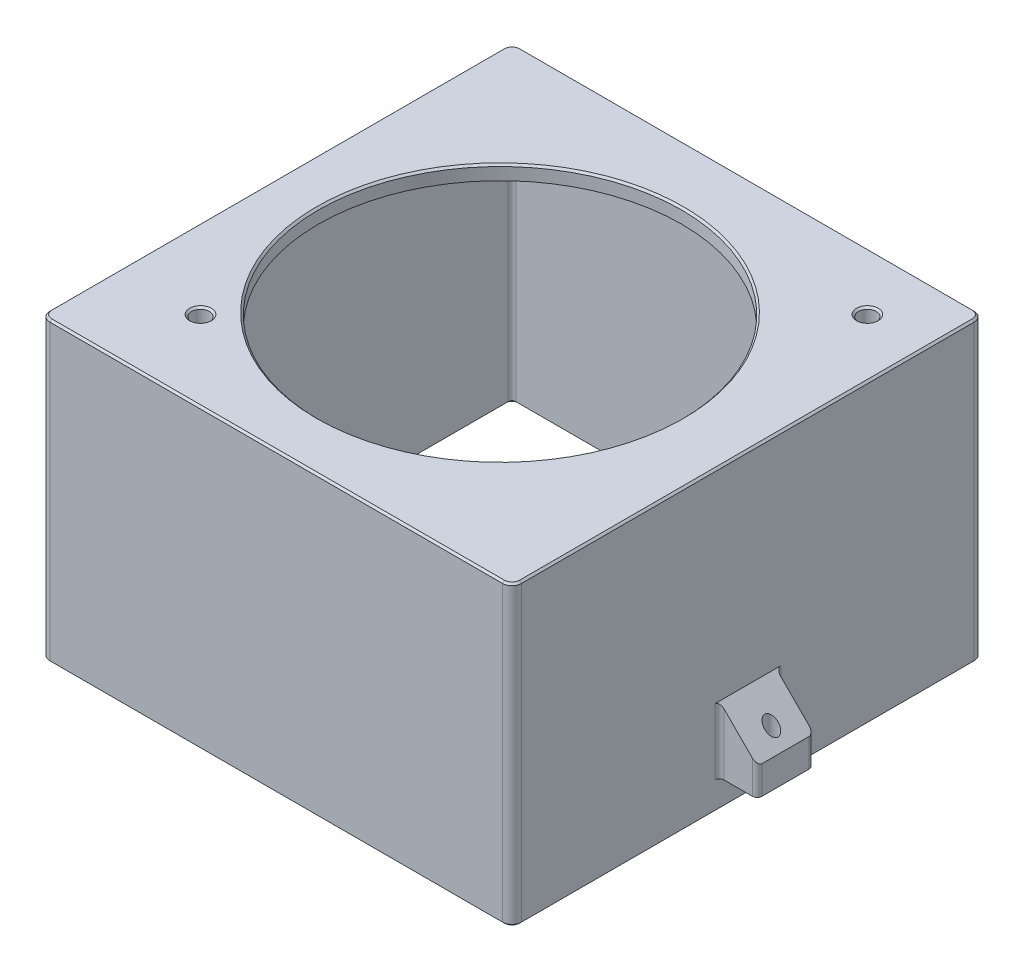
from build123d import *

# Parameters (mm, degrees)
SKETCH_1_W          = 100
SKETCH_1_H          = 100
SKETCH_1_R          = 1.9
EXTRUDE_1_DEPTH     = 3
SKETCH_2_R          = 38.5
CUT_EXTRUDE_1_DEPTH = 10
SKETCH_3_W          = 100
SKETCH_3_H          = 100
SKETCH_3_W_2        = 94
SKETCH_3_H_2        = 94
EXTRUDE_2_DEPTH     = 60
FILLET_1_R          = 2
CHAMFER_1_SIZE      = 0.4
FILLET_2_R          = 0.8
CHAMFER_2_SIZE      = 0.4
SKETCH_4_W          = 8
SKETCH_4_H          = 12
EXTRUDE_3_DEPTH     = 6
CHAMFER_3_SIZE      = 8
SKETCH_5_R          = 1.4
CUT_EXTRUDE_2_DEPTH = 158.838525082
FILLET_3_R          = 1


with BuildPart() as part:
    # 草图1 → 凸台-拉伸1 (new body)
    with BuildSketch(Plane(origin=(0, 0, 0), x_dir=(1, 0, 0), z_dir=(0, 1, 0))):
        with Locations((50, -50)):
            Rectangle(SKETCH_1_W, SKETCH_1_H)
        with Locations(Location((16.970562748, -83.029437252, 0), (0, 0, 270))):
            Circle(SKETCH_1_R, mode=Mode.SUBTRACT)
        with Locations(Location((87.681240867, -12.318759133, 0), (0, 0, 270))):
            Circle(SKETCH_1_R, mode=Mode.SUBTRACT)
    extrude(amount=EXTRUDE_1_DEPTH)

    # 草图2 → 切除-拉伸1 (cut)
    with BuildSketch(Plane(origin=(0, 3, 0), x_dir=(1, 0, 0), z_dir=(0, 1, 0))):
        with Locations(Location((48.381240867, -50.918759133, 0), (0, 0, 270))):
            Circle(SKETCH_2_R)
    extrude(amount=-CUT_EXTRUDE_1_DEPTH, mode=Mode.SUBTRACT)

    # 草图3 → 凸台-拉伸2 (add)
    with BuildSketch(Plane.XZ):
        with Locations((50, 50)):
            Rectangle(SKETCH_3_W, SKETCH_3_H)
        with Locations((50, 50)):
            Rectangle(SKETCH_3_W_2, SKETCH_3_H_2, mode=Mode.SUBTRACT)
    extrude(amount=EXTRUDE_2_DEPTH)

    # 圆角1
    fillet_1_edges = [part.edges().sort_by_distance(p)[0] for p in [
        (0, -28.5, 0),
        (100, -28.5, 0),
        (100, -28.5, 100),
        (0, -28.5, 100),
    ]]
    fillet(fillet_1_edges, radius=FILLET_1_R)

    # 倒角1
    chamfer_1_edges = [part.edges().sort_by_distance(p)[0] for p in [
        (16.970562748, 3, 81.129437252),
        (87.681240867, 3, 10.418759133),
        (48.381240867, 3, 12.418759133),
        (50, 3, 0),
        (100, 3, 50),
        (0, 3, 50),
        (50, 3, 100),
        (0.585786438, 3, 99.414213562),
        (0.585786438, 3, 0.585786438),
        (99.414213562, 3, 99.414213562),
        (99.414213562, 3, 0.585786438),
    ]]
    chamfer(chamfer_1_edges, length=CHAMFER_1_SIZE)

    # 圆角2
    fillet_2_edges = [part.edges().sort_by_distance(p)[0] for p in [
        (50, 0, 97),
        (3, 0, 50),
        (50, 0, 3),
        (97, 0, 50),
        (3, -30, 97),
        (3, -30, 3),
        (97, -30, 3),
        (97, -30, 97),
    ]]
    fillet(fillet_2_edges, radius=FILLET_2_R)

    # 倒角2
    chamfer_2_edges = [part.edges().sort_by_distance(p)[0] for p in [
        (50, -60, 97),
        (97, -60, 50),
        (50, -60, 3),
        (3, -60, 50),
        (3.234314575, -60, 3.234314575),
        (96.765685425, -60, 3.234314575),
        (96.765685425, -60, 96.765685425),
        (3.234314575, -60, 96.765685425),
        (50, -60, 0),
        (50, -60, 100),
        (0, -60, 50),
        (100, -60, 50),
        (0.585786438, -60, 99.414213562),
        (0.585786438, -60, 0.585786438),
        (99.414213562, -60, 99.414213562),
        (99.414213562, -60, 0.585786438),
    ]]
    chamfer(chamfer_2_edges, length=CHAMFER_2_SIZE)

    # 草图4 → 凸台-拉伸3 (add)
    with BuildSketch(Plane(origin=(0, -54, 0), x_dir=(-1, 0, 0), z_dir=(0, -1, 0))):
        with Locations((-104, -50)):
            Rectangle(SKETCH_4_W, SKETCH_4_H)
        with Locations((4, -50)):
            Rectangle(SKETCH_4_W, SKETCH_4_H)
    extrude(amount=-EXTRUDE_3_DEPTH)

    # 倒角3
    chamfer_3_edges = [part.edges().sort_by_distance(p)[0] for p in [
        (0, -48, 50),
        (100, -48, 50),
    ]]
    chamfer(chamfer_3_edges, length=CHAMFER_3_SIZE - 0.0001)  # a hair under: the kernel refuses the full size

    # 草图5 → 切除-拉伸2 (cut, through all)
    with BuildSketch(Plane(origin=(0, -54, 0), x_dir=(-1, 0, 0), z_dir=(0, -1, 0))):
        with Locations(Location((5, -50, 0), (0, 0, 90))):
            Circle(SKETCH_5_R)
        with Locations(Location((-105, -50, 0), (0, 0, 90))):
            Circle(SKETCH_5_R)
    extrude(amount=-CUT_EXTRUDE_2_DEPTH, mode=Mode.SUBTRACT)

    # 圆角3
    fillet_3_edges = [part.edges().sort_by_distance(p)[0] for p in [
        (100, -47.00005, 44),
        (100, -47.00005, 56),
        (108, -51, 56),
        (108, -51, 44),
        (0, -47.00005, 56),
        (0, -47.00005, 44),
        (-8, -51, 44),
        (-8, -51, 56),
    ]]
    fillet(fillet_3_edges, radius=FILLET_3_R)


solid = part.part
